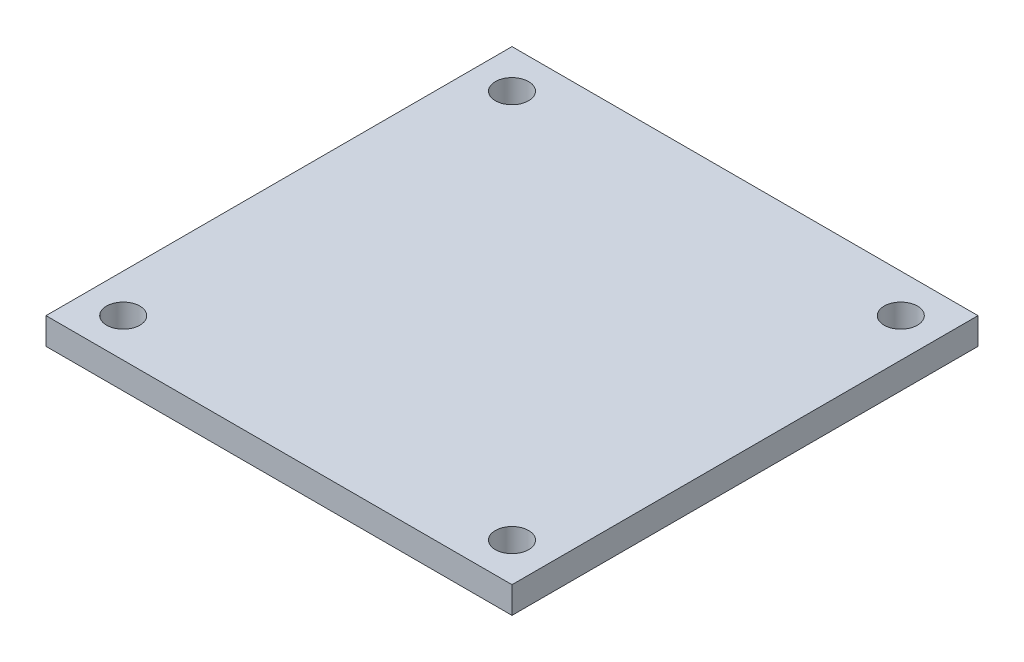
from build123d import *

# Parameters (mm, degrees)
SKETCH1_W           = 35
SKETCH1_H           = 35
BOSS_EXTRUDE1_DEPTH = 2
SKETCH2_R           = 1.25
CUT_EXTRUDE1_DEPTH  = 25.829418036


with BuildPart() as part:
    # Sketch1 → Boss-Extrude1 (new body)
    with BuildSketch(Plane(origin=(0, 0, 0), x_dir=(1, 0, 0), z_dir=(0, 1, 0))):
        Rectangle(SKETCH1_W, SKETCH1_H)
    extrude(amount=BOSS_EXTRUDE1_DEPTH)

    # Sketch2 → Cut-Extrude1 (cut, through all)
    with BuildSketch(Plane(origin=(0, 2, 0), x_dir=(1, 0, 0), z_dir=(0, 1, 0))):
        with Locations((-14.6, -14.6)):
            Circle(SKETCH2_R)
        with Locations((14.6, -14.6)):
            Circle(SKETCH2_R)
        with Locations((-14.6, 14.6)):
            Circle(SKETCH2_R)
        with Locations((14.6, 14.6)):
            Circle(SKETCH2_R)
    extrude(amount=-CUT_EXTRUDE1_DEPTH, mode=Mode.SUBTRACT)


solid = part.part
